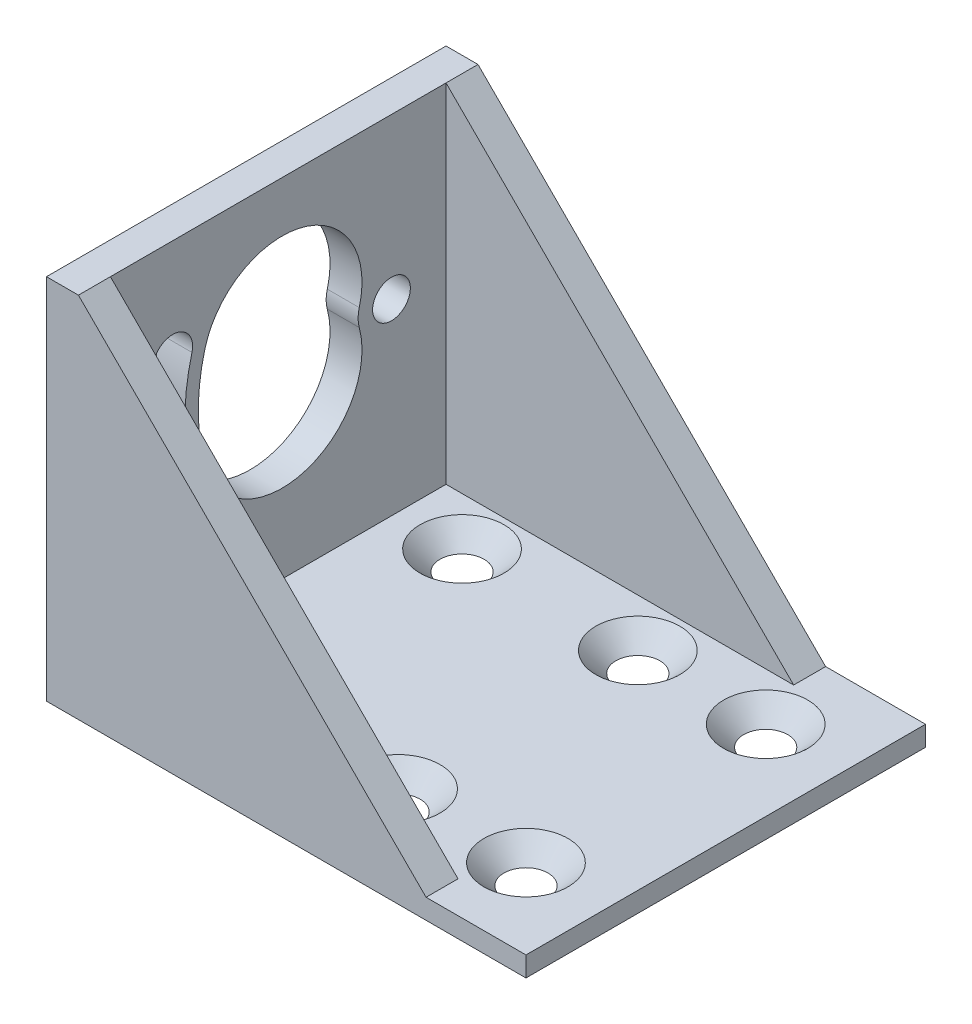
from build123d import *

# Parameters (mm, degrees)
BOSS_EXTRUDE1_DEPTH = 31.75
SKETCH2_R           = 6.35
CUT_EXTRUDE1_DEPTH  = 58.557767504
SKETCH3_R           = 1.5
CUT_EXTRUDE2_DEPTH  = 58.557767504
BOSS_EXTRUDE2_DEPTH = 2.54
BOSS_EXTRUDE3_START = -29.21
BOSS_EXTRUDE3_DEPTH = 2.54
SKETCH5_R           = 1.75
CUT_EXTRUDE3_DEPTH  = 2.54
CHAMFER1_SIZE       = 1.5875


with BuildPart() as part:
    # Sketch1 → Boss-Extrude1 (new body)
    with BuildSketch(Plane.XY):
        Polygon((0, 0), (0, 29.21), (2.54, 29.21), (2.54, 1.5875), (38.1, 1.5875), (38.1, 0), align=None)
    extrude(amount=BOSS_EXTRUDE1_DEPTH)

    # Sketch2 → Cut-Extrude1 (cut, through all)
    with BuildSketch(Plane.ZY):
        with Locations((15.875, 16.51)):
            Circle(SKETCH2_R)
    extrude(amount=-CUT_EXTRUDE1_DEPTH, mode=Mode.SUBTRACT)

    # Sketch3 → Cut-Extrude2 (cut, through all)
    with BuildSketch(Plane.ZY):
        with Locations((6.875, 16.51)):
            Circle(SKETCH3_R)
        with BuildLine():
            ThreePointArc((21.701961434, 12.537127658), (22.225, 16.51), (21.701961434, 20.482872342))
            ThreePointArc((21.701961434, 20.482872342), (13.9248315, 24.973000403), (9.43470344, 17.19587047))
            ThreePointArc((9.43470344, 17.19587047), (9.525, 16.51), (9.43470344, 15.82412953))
            ThreePointArc((9.43470344, 15.82412953), (13.9248315, 8.046999597), (21.701961434, 12.537127658))
        make_face()
        with BuildLine():
            ThreePointArc((25.79507191, 11.440382011), (26.46249978, 16.51), (25.79507191, 21.579617989))
            ThreePointArc((25.79507191, 21.579617989), (23.850789427, 22.702150004), (22.728257411, 20.757867521))
            ThreePointArc((22.728257411, 20.757867521), (23.28749978, 16.51), (22.728257411, 12.262132479))
            ThreePointArc((22.728257411, 12.262132479), (23.850789427, 10.317849996), (25.79507191, 11.440382011))
        make_face()
    extrude(amount=-CUT_EXTRUDE2_DEPTH, mode=Mode.SUBTRACT)

    # Sketch4 → Boss-Extrude2 (add)
    with BuildSketch(Plane.XY.offset(31.75)):
        Polygon((2.54, 29.21), (30.1625, 1.5875), (2.54, 1.5875), align=None)
    extrude(amount=-BOSS_EXTRUDE2_DEPTH)

    # Sketch4<2> → Boss-Extrude3 (add)
    with BuildSketch(Plane.XY.offset(31.75).offset(BOSS_EXTRUDE3_START)):
        Polygon((2.54, 29.21), (30.1625, 1.5875), (2.54, 1.5875), align=None)
    extrude(amount=-BOSS_EXTRUDE3_DEPTH)

    # Sketch5 → Cut-Extrude3 (cut)
    with BuildSketch(Plane(origin=(0, 1.5875, 0), x_dir=(1, 0, 0), z_dir=(0, 1, 0))):
        with Locations(Location((7.62, -6.35, 0), (0, 0, 270))):
            Circle(SKETCH5_R)
        with Locations(Location((31.75, -25.4, 0), (0, 0, 270))):
            Circle(SKETCH5_R)
        with Locations(Location((31.75, -6.35, 0), (0, 0, 270))):
            Circle(SKETCH5_R)
        with Locations(Location((7.62, -25.4, 0), (0, 0, 270))):
            Circle(SKETCH5_R)
        with Locations(Location((21.59, -6.35, 0), (0, 0, 270))):
            Circle(SKETCH5_R)
        with Locations(Location((21.59, -25.4, 0), (0, 0, 270))):
            Circle(SKETCH5_R)
    extrude(amount=-CUT_EXTRUDE3_DEPTH, mode=Mode.SUBTRACT)

    # Chamfer1
    chamfer1_edges = [part.edges().sort_by_distance(p)[0] for p in [
        (31.75, 1.5875, 23.65),
        (31.75, 1.5875, 4.6),
        (7.62, 1.5875, 23.65),
        (21.59, 1.5875, 23.65),
        (21.59, 1.5875, 4.6),
        (7.62, 1.5875, 4.6),
    ]]
    chamfer(chamfer1_edges, length=CHAMFER1_SIZE - 0.0001)  # a hair under: the kernel refuses the full size


solid = part.part
